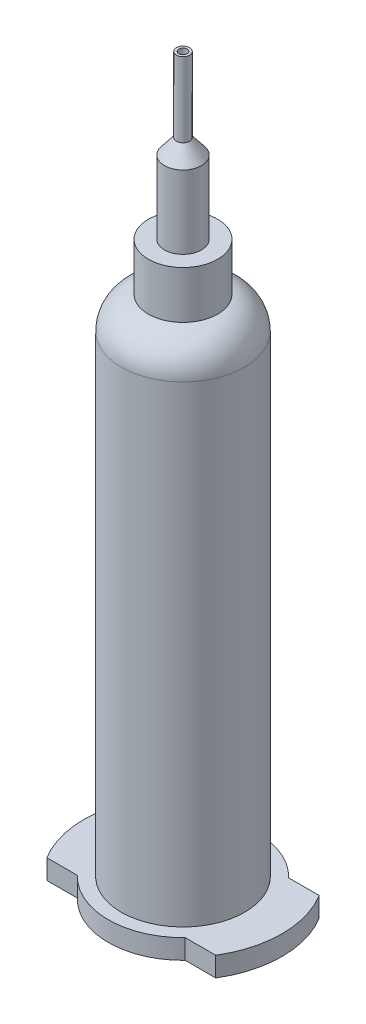
from build123d import *

# Parameters (mm, degrees)
FILLET1_R           = 5
CUT_EXTRUDE1_DEPTH  = 3
SKETCH4_R           = 7.925
CUT_EXTRUDE2_DEPTH  = 74.00000000000003
SKETCH5_R           = 0.6273709550774836
CUT_EXTRUDE3_DEPTH  = 41.000000000000014
FILLET3_R           = 10
SKETCH6_R           = 7.925
BOSS_EXTRUDE2_DEPTH = 14.999999999999993


with BuildPart() as part:
    # Sketch2 → Revolve1 (revolve)
    with BuildSketch(Plane.XY, mode=Mode.PRIVATE) as revolve1_sk:
        Polygon((1.0000000000000129, 54.38), (1.27e-14, 54.38), (1.27e-14, -54.38), (1.041e-14, -57.38000000000001), (15.075000000000014, -57.38000000000001), (15.075000000000014, -54.38), (9.400000000000002, -54.38), (9.399999999999997, 22.380000000000003), (5.275000000000004, 22.380000000000003), (5.275000000000002, 29.620000000000005), (2.8250000000000037, 29.620000000000005), (2.825000000000002, 40.74), (1.0000000000000142, 43.03000000000001), align=None)
    revolve(revolve1_sk.sketch.rotate(Axis((0, 24.52235384982656, 0), (0, -1, 0)), 90), axis=Axis((0, 24.52235384982656, 0), (0, -1, 0)))

    # Fillet1
    # the kernel refuses this fillet: 5 mm, written as the material it takes off along each edge
    with BuildSketch(Plane(origin=(0, 22.380000000000003, 0), x_dir=(1.1e-16, 0, 1), z_dir=(1, 0, -1.1e-16))) as fillet1_piece_1:
        with BuildLine():
            CenterArc((4.400000000000002, 4.922842166879796), FILLET1_R, 280.0786581077857, 79.92134189221429)
            Line((5.274999999999833, 9.6279e-13), (5.29249999999983, -0.09845684333661353))
            ThreePointArc((5.29249999999983, -0.09845684333661353), (7.337499999999915, -0.10000000000000142), (9.399999999999997, -0.10000000000000142))
            Line((9.399999999999997, -0.10000000000000142), (9.499999999999996, 0))
            Line((9.499999999999996, 0), (9.500000000000002, 4.922842166879796))
            Line((9.500000000000002, 4.922842166879796), (9.400000000000002, 4.922842166879796))
        make_face()
    revolve(axis=Axis((0, 22.380000000000003, 0), (0, -1, 0)), mode=Mode.SUBTRACT)

    # Sketch3 → Cut-Extrude1 (cut)
    with BuildSketch(Plane(origin=(0, -54.38, 0), x_dir=(1, 0, 0), z_dir=(0, 1, 0))):
        with BuildLine():
            Line((-12.854571171377145, 7.875), (-8.208227579691002, 7.875))
            ThreePointArc((-8.208227579691002, 7.875), (7e-16, 11.375), (8.208227579691002, 7.875))
            Line((8.208227579691002, 7.875), (12.854571171377145, 7.875))
            ThreePointArc((12.854571171377145, 7.875), (9.2e-16, 15.075000000000014), (-12.854571171377145, 7.875))
        make_face()
        with BuildLine():
            Line((-12.854571171377145, -7.875), (-8.208227579691002, -7.875))
            ThreePointArc((-8.208227579691002, -7.875), (7e-16, -11.375), (8.208227579691002, -7.875))
            Line((8.208227579691002, -7.875), (12.854571171377145, -7.875))
            ThreePointArc((12.854571171377145, -7.875), (9.2e-16, -15.075000000000014), (-12.854571171377145, -7.875))
        make_face()
    extrude(amount=-CUT_EXTRUDE1_DEPTH, mode=Mode.SUBTRACT)

    # Sketch4 → Cut-Extrude2 (cut)
    with BuildSketch(Plane.XZ.offset(57.38000000000001)):
        with Locations(Location((0, 0, 0), (0, 0, 270))):
            Circle(SKETCH4_R)
    extrude(amount=-CUT_EXTRUDE2_DEPTH, mode=Mode.SUBTRACT)

    # Sketch5 → Cut-Extrude3 (cut)
    with BuildSketch(Plane(origin=(0, 54.38, 0), x_dir=(1, 0, 0), z_dir=(0, 1, 0))):
        with Locations(Location((0, 0, 0), (0, 0, 270))):
            Circle(SKETCH5_R)
    extrude(amount=-CUT_EXTRUDE3_DEPTH, mode=Mode.SUBTRACT)

    # Fillet3
    # the kernel refuses this fillet: 10 mm, written as the material it takes off along each edge
    with BuildSketch(Plane(origin=(0, 16.62000000000002, 0), x_dir=(-1.8e-16, 0, 1), z_dir=(-1, 0, -1.8e-16))) as fillet3_piece_1:
        with BuildLine():
            CenterArc((10.627370955077483, 9.627938056570244), FILLET3_R, 180, 74.32162410207388)
            Line((7.925, 0), (7.87095258089845, -0.19255876113140502))
            ThreePointArc((7.87095258089845, -0.19255876113140502), (4.276185477538742, -0.1999999999999993), (0.6273709550774836, -0.1999999999999993))
            Line((0.6273709550774836, -0.1999999999999993), (0.4273709550774836, 0))
            Line((0.4273709550774836, 0), (0.42737095507748285, 9.627938056570244))
            Line((0.42737095507748285, 9.627938056570244), (0.6273709550774829, 9.627938056570244))
        make_face()
    revolve(axis=Axis((0, 16.62000000000002, 0), (0, 1, 0)), mode=Mode.SUBTRACT)


with BuildPart() as body_2:
    # Sketch6 → Boss-Extrude2 (new body)
    with BuildSketch(Plane(origin=(0, 16.620000000000015, 0), x_dir=(1, 0, 0), z_dir=(0, 1, 0))):
        with Locations(Location((0, 0, 0), (0, 0, 270))):
            Circle(SKETCH6_R)
    extrude(amount=-BOSS_EXTRUDE2_DEPTH)


solid = Compound([part.part, body_2.part])
